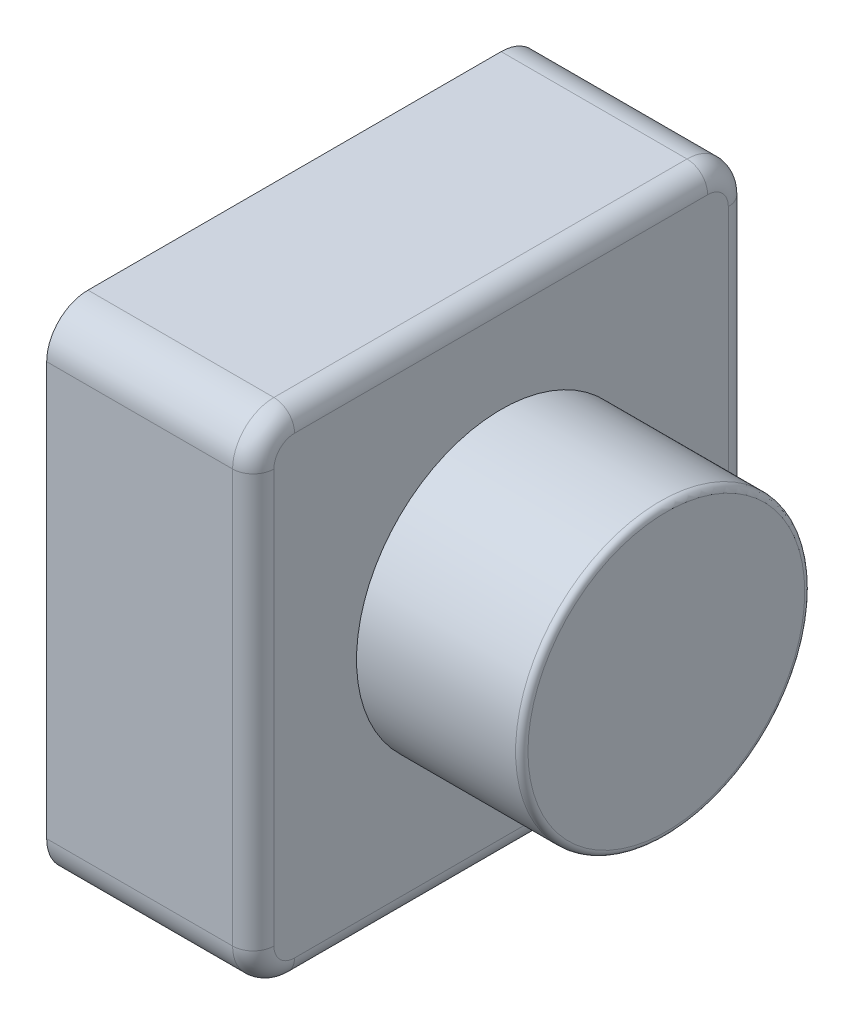
from build123d import *

# Parameters (mm, degrees)
SKETCH1_W               = 120
SKETCH1_H               = 120
BOSS_EXTRUDE1_DEPTH     = 50
SKETCH2_R               = 35
BOSS_EXTRUDE2_DEPTH     = 40
CUT_EXTRUDE1_DEPTH      = 193.093727123
CUT_EXTRUDE1_DEPTH_BACK = 193.093727123
SKETCH3_R               = 25
FILLET2_R               = 10
FILLET3_R               = 1.5
FILLET5_R               = 5
SHELL1_T                = -2


with BuildPart() as part:
    # Sketch1 → Boss-Extrude1 (new body)
    with BuildSketch(Plane(origin=(0, 0, 0), x_dir=(0, 0, -1), z_dir=(1, 0, 0))):
        with Locations((-60, 60)):
            Rectangle(SKETCH1_W, SKETCH1_H)
    extrude(amount=BOSS_EXTRUDE1_DEPTH)

    # Sketch3 → Cut-Extrude1 (cut, two sides: drawn at the far end of the back side and taken through both)
    with BuildSketch(Plane(origin=(90, 0, 0), x_dir=(0, 0, -1), z_dir=(1, 0, 0)).offset(-CUT_EXTRUDE1_DEPTH_BACK)):
        with Locations((-60, 60)):
            Circle(SKETCH3_R)
    extrude(amount=CUT_EXTRUDE1_DEPTH + CUT_EXTRUDE1_DEPTH_BACK, mode=Mode.SUBTRACT)

    # Fillet2
    fillet2_edges = [part.edges().sort_by_distance(p)[0] for p in [
        (25, 0, 0),
        (25, 0, 120),
        (25, 120, 120),
        (25, 120, 0),
    ]]
    fillet(fillet2_edges, radius=FILLET2_R)

    # Fillet5
    fillet5_edges = [part.edges().sort_by_distance(p)[0] for p in [
        (50, 2.928932188, 117.071067812),
        (50, 60, 120),
        (50, 117.071067812, 117.071067812),
        (50, 120, 60),
        (50, 117.071067812, 2.928932188),
        (50, 60, 0),
        (50, 2.928932188, 2.928932188),
        (50, 0, 60),
        (50, 60, 85),
    ]]
    fillet(fillet5_edges, radius=FILLET5_R)

    # Shell1
    shell1_openings = [part.faces().sort_by_distance(p)[0] for p in [
        (0, 1.697056275, 60),
    ]]
    offset(amount=SHELL1_T, openings=shell1_openings, kind=Kind.INTERSECTION)


with BuildPart() as body_2:
    # Sketch2 → Boss-Extrude2 (new body)
    with BuildSketch(Plane(origin=(50, 0, 0), x_dir=(0, 0, -1), z_dir=(1, 0, 0))):
        with Locations((-60, 60)):
            Circle(SKETCH2_R)
    extrude(amount=BOSS_EXTRUDE2_DEPTH)

    # Fillet3
    fillet3_edges = [body_2.edges().sort_by_distance(p)[0] for p in [
        (90, 60, 95),
    ]]
    fillet(fillet3_edges, radius=FILLET3_R)


solid = Compound([part.part, body_2.part])
